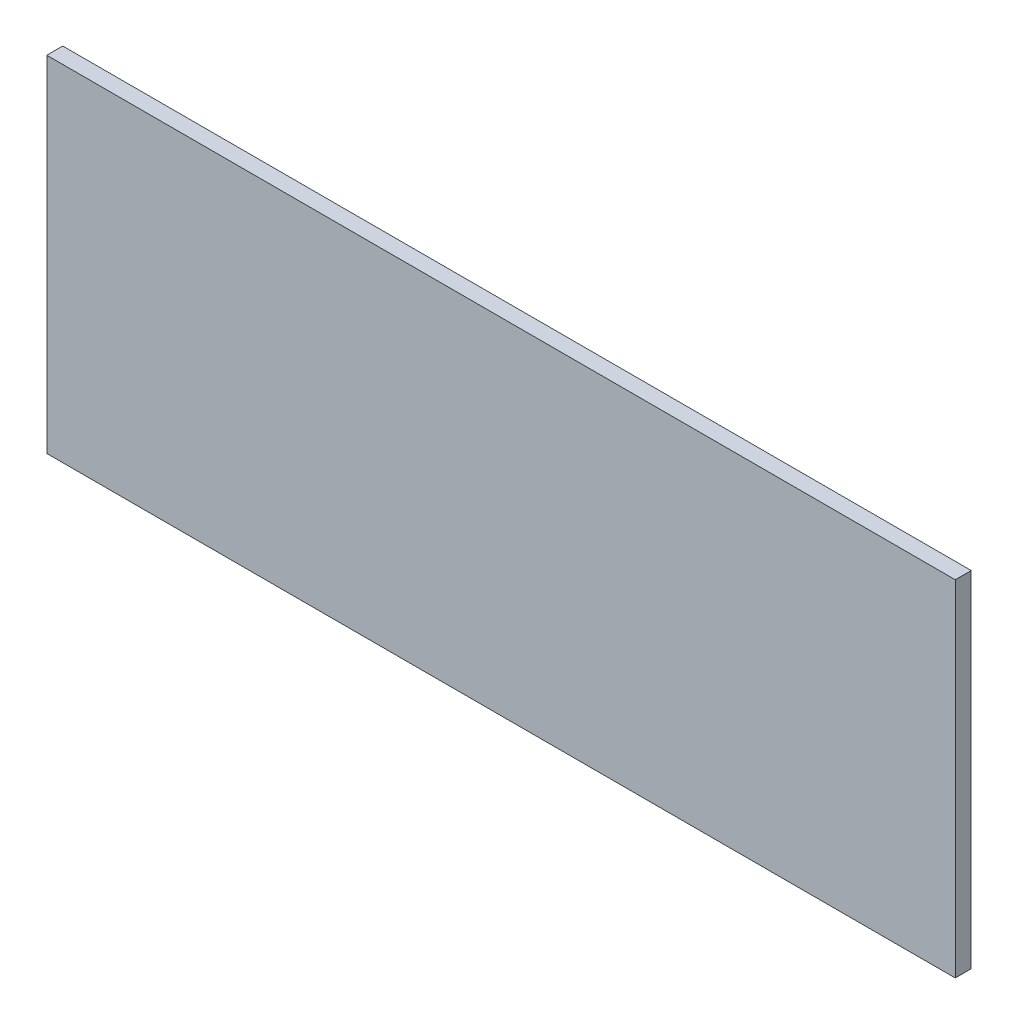
from build123d import *

# Parameters (mm, degrees)
SKETCH1_W          = 108
SKETCH1_H          = 41
BASE_FLANGE1_DEPTH = 1.89738


# Sheet-metal steps are written as plain solids
with BuildPart() as part:
    # Sketch1 → Base-Flange1 (new body)
    with BuildSketch(Plane.XY):
        with Locations((4.059333085, 30.957431136)):
            Rectangle(SKETCH1_W, SKETCH1_H)
    extrude(amount=-BASE_FLANGE1_DEPTH)


solid = part.part
